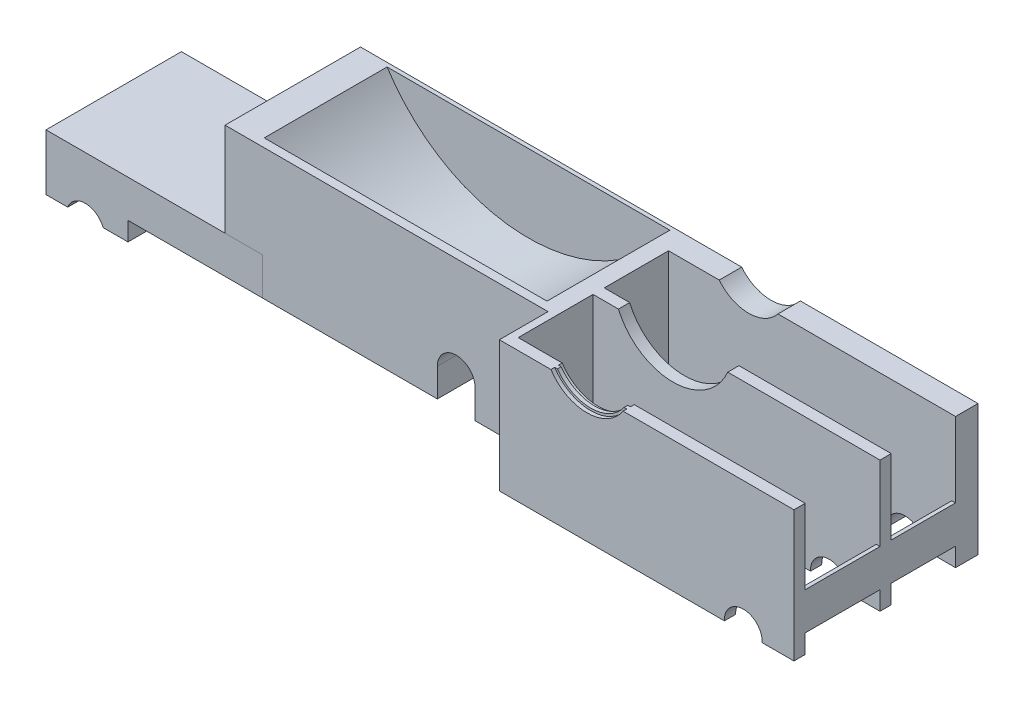
from build123d import *

# Parameters (mm, degrees)
SKETCH1_W           = 419.1
SKETCH1_H           = 142.18412
BOSS_EXTRUDE1_DEPTH = 88.9
SKETCH2_R           = 119.38
CUT_EXTRUDE1_DEPTH  = 83.4009
SKETCH7_W           = 194.780719179
SKETCH7_H           = 43.63974
SKETCH7_H_2         = 50.8
CUT_EXTRUDE2_DEPTH  = 452.402640644
SKETCH4_R           = 40.386
CUT_EXTRUDE4_DEPTH  = 10
SKETCH18_R          = 25.527
CUT_EXTRUDE11_DEPTH = 23.09114
SKETCH5_R           = 27.686
CUT_EXTRUDE5_DEPTH  = 448.05209497
SKETCH8_W           = 419.1
SKETCH8_H           = 88.9
CUT_EXTRUDE6_DEPTH  = 7.85114
SKETCH9_W           = 419.1
SKETCH9_H           = 88.9
CUT_EXTRUDE7_DEPTH  = 11.94308
SKETCH10_W          = 219.202
SKETCH10_H          = 88.9
CUT_EXTRUDE8_DEPTH  = 30.48
SKETCH12_W          = 121.533574186
SKETCH12_H          = 91.9099
BOSS_EXTRUDE2_DEPTH = 25.4
SKETCH14_W          = 55.647095764
SKETCH14_H          = 91.9099
BOSS_EXTRUDE3_DEPTH = 12.7
CUT_EXTRUDE10_REACH = 447.564
SKETCH17_R          = 12.827
SKETCH20_W          = 2.54
SKETCH20_H          = 25.4
BOSS_EXTRUDE4_DEPTH = 102.05974
SPLIT2_START        = -134.33298
SPLIT2_DEPTH        = 91.9099
SPLIT2_START_2      = -48.23206
SPLIT2_2_DEPTH      = 5.80898
SPLIT2_3_DEPTH      = 2.70002
SPLIT2_4_DEPTH      = 91.9099
SPLIT2_START_3      = -121.533574186
SPLIT2_5_DEPTH      = 340.735574186
SKETCH22_W          = 199.898
SKETCH22_H          = 88.9
BOSS_EXTRUDE5_DEPTH = 2.54
SKETCH24_R          = 29.21
CUT_EXTRUDE12_DEPTH = 2.54
CUT_EXTRUDE13_START = -5.08
SKETCH24_4_R        = 29.21
CUT_EXTRUDE13_DEPTH = 2.55016
SKETCH29_R          = 12.827
CUT_EXTRUDE14_DEPTH = 446.564033133
BOSS_EXTRUDE7_DEPTH = 91.9099


# Read off the part's stored shape, not the designer's step: Split2
with BuildPart() as part:
    # Sketch1 → Boss-Extrude1 (new body)
    with BuildSketch(Plane(origin=(0, 0, 0), x_dir=(1, 0, 0), z_dir=(0, 1, 0))):
        with Locations((209.55, 71.09206)):
            Rectangle(SKETCH1_W, SKETCH1_H)
    extrude(amount=BOSS_EXTRUDE1_DEPTH)

    # Sketch2 → Cut-Extrude1 (cut)
    with BuildSketch(Plane(origin=(0, 0, -131.63296), x_dir=(-1, 0, 0), z_dir=(0, 0, -1))):
        with Locations((-116.7166499, 150.061217688)):
            Circle(SKETCH2_R)
    extrude(amount=-CUT_EXTRUDE1_DEPTH, mode=Mode.SUBTRACT)

    # Sketch7 → Cut-Extrude2 (cut, through all)
    with BuildSketch(Plane(origin=(0, 88.9, 0), x_dir=(1, 0, 0), z_dir=(0, 1, 0))):
        with Locations((321.709640411, 97.27311)):
            Rectangle(SKETCH7_W, SKETCH7_H)
        with Locations((321.709640411, 42.43324)):
            Rectangle(SKETCH7_W, SKETCH7_H_2)
    extrude(amount=-CUT_EXTRUDE2_DEPTH, mode=Mode.SUBTRACT)

    # Sketch4 → Cut-Extrude4 (cut)
    with BuildSketch(Plane(origin=(0, 0, -67.83324), x_dir=(-1, 0, 0), z_dir=(0, 0, -1))):
        with Locations((-278.649352085, 104.852009966)):
            Circle(SKETCH4_R)
    extrude(amount=CUT_EXTRUDE4_DEPTH, mode=Mode.SUBTRACT)

    # Sketch18 → Cut-Extrude11 (cut)
    with BuildSketch(Plane(origin=(0, 0, -142.18412), x_dir=(-1, 0, 0), z_dir=(0, 0, -1))):
        with Locations((-278.649352085, 104.852009966)):
            Circle(SKETCH18_R)
    extrude(amount=-CUT_EXTRUDE11_DEPTH, mode=Mode.SUBTRACT)

    # Sketch5 → Cut-Extrude5 (cut, through all)
    with BuildSketch(Plane(origin=(0, 0, -14.48308), x_dir=(-1, 0, 0), z_dir=(0, 0, -1))):
        with Locations((-278.649352085, 104.852009966)):
            Circle(SKETCH5_R)
    extrude(amount=-CUT_EXTRUDE5_DEPTH, mode=Mode.SUBTRACT)

    # Sketch8 → Cut-Extrude6 (cut)
    with BuildSketch(Plane(origin=(0, 0, -142.18412), x_dir=(-1, 0, 0), z_dir=(0, 0, -1))):
        with Locations((-209.55, 44.45)):
            Rectangle(SKETCH8_W, SKETCH8_H)
    extrude(amount=-CUT_EXTRUDE6_DEPTH, mode=Mode.SUBTRACT)

    # Sketch9 → Cut-Extrude7 (cut)
    with BuildSketch(Plane.XY):
        with Locations((209.55, 44.45)):
            Rectangle(SKETCH9_W, SKETCH9_H)
    extrude(amount=-CUT_EXTRUDE7_DEPTH, mode=Mode.SUBTRACT)

    # Sketch10 → Cut-Extrude8 (cut)
    with BuildSketch(Plane.XY.offset(-11.94308)):
        with Locations((109.601, 44.45)):
            Rectangle(SKETCH10_W, SKETCH10_H)
    extrude(amount=-CUT_EXTRUDE8_DEPTH, mode=Mode.SUBTRACT)

    # Sketch12 → Boss-Extrude2 (add)
    with BuildSketch(Plane.XZ):
        with Locations((-60.766787093, -88.37803)):
            Rectangle(SKETCH12_W, SKETCH12_H)
    extrude(amount=-BOSS_EXTRUDE2_DEPTH)

    # Sketch14 → Boss-Extrude3 (add)
    with BuildSketch(Plane.XZ):
        with Locations((-93.710026304, -88.37803)):
            Rectangle(SKETCH14_W, SKETCH14_H)
    extrude(amount=BOSS_EXTRUDE3_DEPTH)

    # Cut-Extrude10: up to this face of the body (flat: up to its plane)
    cut_extrude10_end = Plane(part.part.faces().sort_by_distance((320.017892525, 43.601141034, -11.94308))[0])
    # Sketch17 → Cut-Extrude10 (cut, up to the picked face)
    with BuildSketch(Plane(origin=(0, 0, -134.33298), x_dir=(-1, 0, 0), z_dir=(0, 0, -1)), mode=Mode.PRIVATE) as cut_extrude10_sk1:
        with Locations((-384.735935495, 0.531880938)):
            Circle(SKETCH17_R)
    cut_extrude10_tool1 = split(extrude(cut_extrude10_sk1.sketch, amount=-CUT_EXTRUDE10_REACH, mode=Mode.PRIVATE), bisect_by=cut_extrude10_end, keep=Keep.BOTH, mode=Mode.PRIVATE)
    # Sketch17 → Cut-Extrude10 (cut, up to the picked face)
    with BuildSketch(Plane(origin=(0, 0, -134.33298), x_dir=(-1, 0, 0), z_dir=(0, 0, -1)), mode=Mode.PRIVATE) as cut_extrude10_sk2:
        with Locations((94.798916194, -17.274045482)):
            Circle(SKETCH17_R)
    cut_extrude10_tool2 = split(extrude(cut_extrude10_sk2.sketch, amount=-CUT_EXTRUDE10_REACH, mode=Mode.PRIVATE), bisect_by=cut_extrude10_end, keep=Keep.BOTH, mode=Mode.PRIVATE)
    # Sketch17 → Cut-Extrude10 (cut, up to the picked face)
    with BuildSketch(Plane(origin=(0, 0, -134.33298), x_dir=(-1, 0, 0), z_dir=(0, 0, -1)), mode=Mode.PRIVATE) as cut_extrude10_sk3:
        with BuildLine():
            Line((-169.736021607, 19.31637742), (-169.736021607, 0))
            Line((-169.736021607, 0), (-144.082021607, 0))
            Line((-144.082021607, 0), (-144.082021607, 19.31637742))
            ThreePointArc((-144.082021607, 19.31637742), (-156.909021607, 32.14337742), (-169.736021607, 19.31637742))
        make_face()
    cut_extrude10_tool3 = split(extrude(cut_extrude10_sk3.sketch, amount=-CUT_EXTRUDE10_REACH, mode=Mode.PRIVATE), bisect_by=cut_extrude10_end, keep=Keep.BOTH, mode=Mode.PRIVATE)
    add(cut_extrude10_tool1.solids().sort_by(Axis((384.735935, 0.531881, -134.33298), (0, 0, 1)))[0], mode=Mode.SUBTRACT)
    add(cut_extrude10_tool2.solids().sort_by(Axis((-94.798916, -17.274045, -134.33298), (0, 0, 1)))[0], mode=Mode.SUBTRACT)
    add(cut_extrude10_tool3.solids().sort_by(Axis((156.909022, 14.834778, -134.33298), (0, 0, 1)))[0], mode=Mode.SUBTRACT)

    # Sketch20 → Boss-Extrude4 (add)
    with BuildSketch(Plane(origin=(0, 0, -17.03324), x_dir=(-1, 0, 0), z_dir=(0, 0, -1))):
        with Locations((-417.83, 25.4)):
            Rectangle(SKETCH20_W, SKETCH20_H)
    extrude(amount=BOSS_EXTRUDE4_DEPTH)

    # Split2 5 outline → Split2 5 (cut)
    with BuildSketch(Plane.YZ.offset(SPLIT2_START_3)):
        Polygon((-12.7, -42.42308), (-12.7, -134.33298), (88.9, -134.33298), (88.9, -131.63296), (88.9, -48.23206), (88.9, -42.42308), align=None)
    extrude(amount=SPLIT2_5_DEPTH, mode=Mode.SUBTRACT)

    # Sketch22 → Boss-Extrude5 (add)
    with BuildSketch(Plane.XY.offset(-11.94308)):
        with Locations((319.151, 44.45)):
            Rectangle(SKETCH22_W, SKETCH22_H)
    extrude(amount=BOSS_EXTRUDE5_DEPTH)

    # Sketch24 → Cut-Extrude12 (cut)
    with BuildSketch(Plane.XY.offset(-9.40308)):
        with Locations((278.649352085, 104.852009966)):
            Circle(SKETCH24_R)
    extrude(amount=-CUT_EXTRUDE12_DEPTH, mode=Mode.SUBTRACT)

    # Sketch24<4> → Cut-Extrude13 (cut)
    with BuildSketch(Plane.XY.offset(-9.40308).offset(CUT_EXTRUDE13_START)):
        with Locations((278.649352085, 104.852009966)):
            Circle(SKETCH24_4_R)
    extrude(amount=-CUT_EXTRUDE13_DEPTH, mode=Mode.SUBTRACT)

    # Sketch29 → Cut-Extrude14 (cut, through all)
    with BuildSketch(Plane(origin=(0, 0, -11.94308), x_dir=(-1, 0, 0), z_dir=(0, 0, -1))):
        with Locations((-384.735935495, 0.531880938)):
            Circle(SKETCH29_R)
    extrude(amount=-CUT_EXTRUDE14_DEPTH, mode=Mode.SUBTRACT)



with BuildPart() as body_2:
    # Split2 outline → Split2 (new body)
    with BuildSketch(Plane.XY.offset(SPLIT2_START)):
        with BuildLine():
            Line((219.202, 0), (219.202, 88.837550574))
            ThreePointArc((219.202, 88.837550574), (116.680284427, 30.681223227), (14.194018979, 88.9))
            Line((14.194018979, 88.9), (0, 88.9))
            Line((0, 88.9), (0, 25.4))
            Line((0, 25.4), (25.4, 25.4))
            Line((25.4, 25.4), (25.4, 0))
            Line((25.4, 0), (144.082021607, 0))
            Line((144.082021607, 0), (144.082021607, 19.31637742))
            ThreePointArc((144.082021607, 19.31637742), (156.909021607, 32.14337742), (169.736021607, 19.31637742))
            Line((169.736021607, 19.31637742), (169.736021607, 0))
            Line((169.736021607, 0), (219.202, 0))
        make_face()
    extrude(amount=SPLIT2_DEPTH)

    # Split2 2 outline → Split2 2 (add)
    with BuildSketch(Plane.XY.offset(SPLIT2_START_2)):
        with BuildLine():
            Line((219.202, 88.837550574), (219.202, 88.9))
            Line((219.202, 88.9), (14.194018979, 88.9))
            ThreePointArc((14.194018979, 88.9), (116.680284427, 30.681223227), (219.202, 88.837550574))
        make_face()
    extrude(amount=SPLIT2_2_DEPTH)

    # Split2 3 outline → Split2 3 (add)
    with BuildSketch(Plane.XY.offset(SPLIT2_START)):
        with BuildLine():
            Line((219.202, 88.837550574), (219.202, 88.9))
            Line((219.202, 88.9), (14.194018979, 88.9))
            ThreePointArc((14.194018979, 88.9), (116.680284427, 30.681223227), (219.202, 88.837550574))
        make_face()
    extrude(amount=SPLIT2_3_DEPTH)


with BuildPart() as body_3:
    # Split2 4 outline → Split2 4 (new body)
    with BuildSketch(Plane.XY.offset(SPLIT2_START)):
        with BuildLine():
            Line((25.4, 0), (25.4, 25.4))
            Line((25.4, 25.4), (-121.533574186, 25.4))
            Line((-121.533574186, 25.4), (-121.533574186, -12.7))
            Line((-121.533574186, -12.7), (-106.782656717, -12.7))
            ThreePointArc((-106.782656717, -12.7), (-94.798916194, -4.447045482), (-82.815175671, -12.7))
            Line((-82.815175671, -12.7), (-65.886478422, -12.7))
            Line((-65.886478422, -12.7), (-65.886478422, 0))
            Line((-65.886478422, 0), (25.4, 0))
        make_face()
    extrude(amount=SPLIT2_4_DEPTH)


with BuildPart() as part_1:
    add(part.part)

    add(body_2.part)  # Boss-Extrude7 merges body 2
    # Sketch30 → Boss-Extrude7 (add)
    with BuildSketch(Plane(origin=(0, 0, -134.33298), x_dir=(-1, 0, 0), z_dir=(0, 0, -1))):
        with BuildLine():
            Line((-14.194018979, 88.9), (-20.758717893, 88.9))
            ThreePointArc((-20.758717893, 88.9), (-116.7166499, 36.269217688), (-212.674581906, 88.9))
            Line((-212.674581906, 88.9), (-219.239280821, 88.9))
            ThreePointArc((-219.239280821, 88.9), (-116.7166499, 30.681217688), (-14.194018979, 88.9))
        make_face()
    extrude(amount=-BOSS_EXTRUDE7_DEPTH)


solid = Compound([body_3.part, part_1.part])
